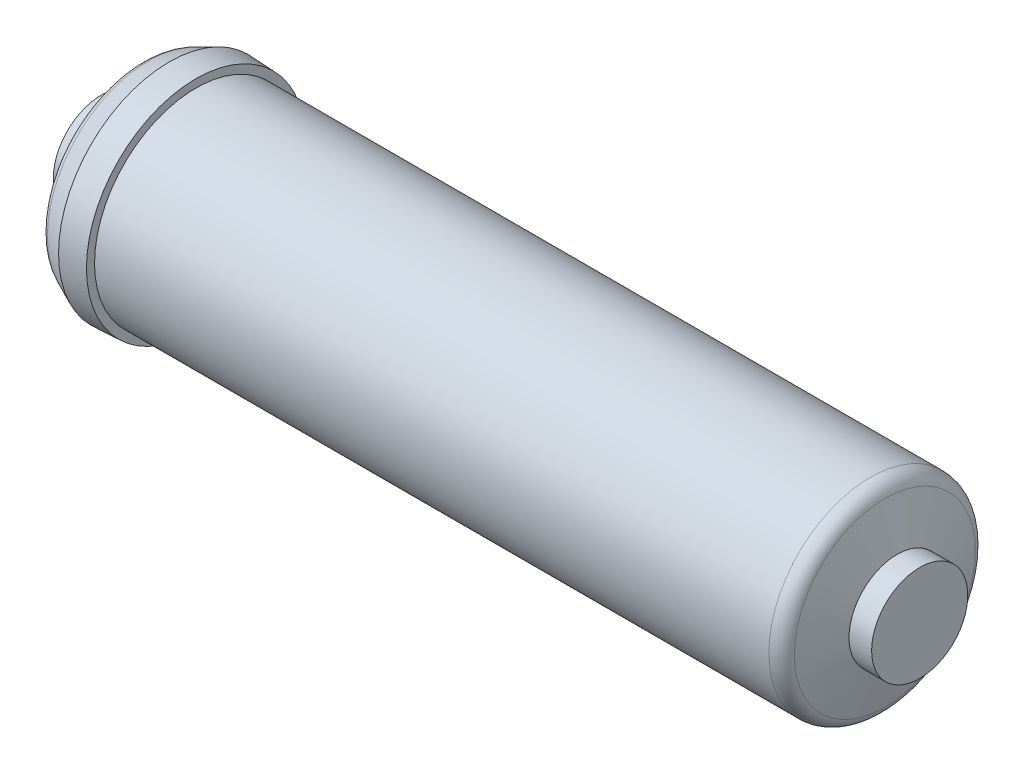
from build123d import *

# Parameters (mm, degrees)
FILLET1_R = 4.7625


with BuildPart() as part:
    # Sketch1 → Revolve1 (revolve)
    with BuildSketch(Plane.XY):
        Polygon((257.175, 0), (257.175, 15.113), (250.063, 15.113), (245.237, 31.877), (29.718, 31.877), (29.718, 34.417), (21.336, 34.798), (12.954, 30.988), (7.9502, 15.113), (0, 15.113), (0, 0), align=None)
    revolve(axis=Axis((0, 0, 0), (1, 0, 0)))

    # Fillet1
    fillet1_edges = [part.edges().sort_by_distance(p)[0] for p in [
        (12.954, -30.988, 0),
        (245.237, -31.877, 0),
    ]]
    fillet(fillet1_edges, radius=FILLET1_R)


solid = part.part
